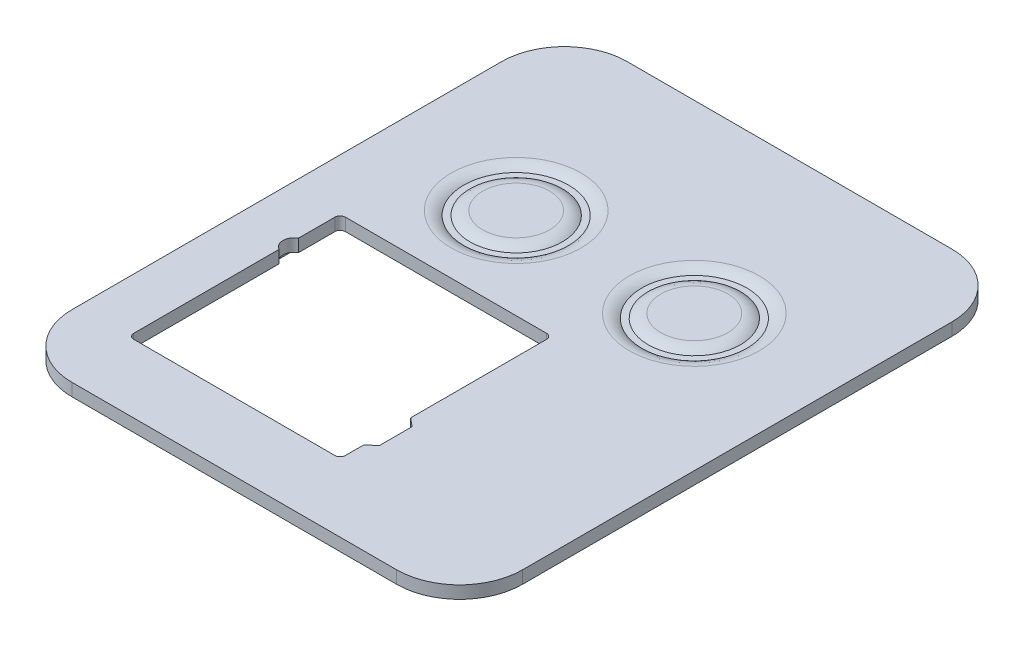
from build123d import *

# Parameters (mm, degrees)
BOSS_EXTRUDE1_DEPTH = 0.6
CUT_EXTRUDE1_DEPTH  = 2
SKETCH3_R           = 0.525
CUT_EXTRUDE2_DEPTH  = 10
BOSS_EXTRUDE2_DEPTH = 0.5
SKETCH5_R           = 2.5
BOSS_EXTRUDE3_DEPTH = 1.3
SKETCH6_R           = 2.5
SKETCH6_R_2         = 2.2
CUT_EXTRUDE3_DEPTH  = 0.2
FILLET1_R           = 1
CHAMFER1_SIZE       = 1


with BuildPart() as part:
    # Sketch1 → Boss-Extrude1 (new body)
    with BuildSketch(Plane(origin=(0, 0, 0), x_dir=(1, 0, 0), z_dir=(0, 1, 0))):
        with BuildLine():
            Line((-7.75, -13.25), (7.75, -13.25))
            ThreePointArc((7.75, -13.25), (9.871320344, -12.371320344), (10.75, -10.25))
            Line((10.75, -10.25), (10.75, 10.25))
            ThreePointArc((10.75, 10.25), (9.871320344, 12.371320344), (7.75, 13.25))
            Line((7.75, 13.25), (-7.75, 13.25))
            ThreePointArc((-7.75, 13.25), (-9.871320344, 12.371320344), (-10.75, 10.25))
            Line((-10.75, 10.25), (-10.75, -10.25))
            ThreePointArc((-10.75, -10.25), (-9.871320344, -12.371320344), (-7.75, -13.25))
        make_face()
    extrude(amount=BOSS_EXTRUDE1_DEPTH)

    # Sketch2 → Cut-Extrude1 (cut)
    with BuildSketch(Plane(origin=(0, 0.6, 0), x_dir=(1, 0, 0), z_dir=(0, 1, 0))):
        with BuildLine():
            Line((1.55, -10), (-8.05, -10))
            ThreePointArc((-8.05, -10), (-8.226776695, -9.926776695), (-8.3, -9.75))
            Line((-8.3, -9.75), (-8.3, -0.15))
            ThreePointArc((-8.3, -0.15), (-8.226776695, 0.026776695), (-8.05, 0.1))
            Line((-8.05, 0.1), (1.55, 0.1))
            ThreePointArc((1.55, 0.1), (1.726776695, 0.026776695), (1.8, -0.15))
            Line((1.8, -0.15), (1.8, -9.75))
            ThreePointArc((1.8, -9.75), (1.726776695, -9.926776695), (1.55, -10))
        make_face()
    extrude(amount=-CUT_EXTRUDE1_DEPTH, mode=Mode.SUBTRACT)

    # Sketch3 → Cut-Extrude2 (cut)
    with BuildSketch(Plane(origin=(0, 0.6, 0), x_dir=(1, 0, 0), z_dir=(0, 1, 0))):
        with Locations((-8.05, -2.35)):
            Circle(SKETCH3_R)
        Polygon((2.2, -6.969264593), (2.2, -8.531138717), (1.8, -8.867190969), (1.8, -6.633227233), align=None)
    extrude(amount=-CUT_EXTRUDE2_DEPTH, mode=Mode.SUBTRACT)

    # Sketch4 → Boss-Extrude2 (add)
    with BuildSketch(Plane(origin=(0, 0, 0), x_dir=(-1, 0, 0), z_dir=(0, -1, 0))):
        with BuildLine():
            Line((7.75, 12.25), (-7.75, 12.25))
            ThreePointArc((-7.75, 12.25), (-9.164213562, 11.664213562), (-9.75, 10.25))
            Line((-9.75, 10.25), (-9.75, -10.25))
            ThreePointArc((-9.75, -10.25), (-9.164213562, -11.664213562), (-7.75, -12.25))
            Line((-7.75, -12.25), (7.75, -12.25))
            ThreePointArc((7.75, -12.25), (9.164213562, -11.664213562), (9.75, -10.25))
            Line((9.75, -10.25), (9.75, 10.25))
            ThreePointArc((9.75, 10.25), (9.164213562, 11.664213562), (7.75, 12.25))
        make_face()
        with BuildLine():
            Line((7.75, 11.5), (-7.75, 11.5))
            ThreePointArc((-7.75, 11.5), (-8.633883476, 11.133883476), (-9, 10.25))
            Line((-9, 10.25), (-9, -10.25))
            ThreePointArc((-9, -10.25), (-8.633883476, -11.133883476), (-7.75, -11.5))
            Line((-7.75, -11.5), (7.75, -11.5))
            ThreePointArc((7.75, -11.5), (8.633883476, -11.133883476), (9, -10.25))
            Line((9, -10.25), (9, 10.25))
            ThreePointArc((9, 10.25), (8.633883476, 11.133883476), (7.75, 11.5))
        make_face(mode=Mode.SUBTRACT)
    extrude(amount=BOSS_EXTRUDE2_DEPTH)

    # Sketch5 → Boss-Extrude3 (add)
    with BuildSketch(Plane(origin=(0, 0, 0), x_dir=(-1, 0, 0), z_dir=(0, -1, 0))):
        with Locations(Location((-4.25, 4.45, 0), (0, 0, 90))):
            Circle(SKETCH5_R)
        with Locations(Location((4.25, 4.45, 0), (0, 0, 90))):
            Circle(SKETCH5_R)
    extrude(amount=BOSS_EXTRUDE3_DEPTH)

    # Sketch6 → Cut-Extrude3 (cut)
    # profile 1 of 2: a face of its own
    with BuildSketch(Plane(origin=(0, 0.6, 0), x_dir=(1, 0, 0), z_dir=(0, 1, 0))):
        with Locations(Location((4.25, 4.45, 0), (0, 0, 90))):
            Circle(SKETCH6_R)
        with Locations(Location((4.25, 4.45, 0), (0, 0, 270))):
            Circle(SKETCH6_R_2, mode=Mode.SUBTRACT)
    # profile 2 of 2: a face of its own
    with BuildSketch(Plane(origin=(0, 0.6, 0), x_dir=(1, 0, 0), z_dir=(0, 1, 0))):
        with Locations(Location((-4.25, 4.45, 0), (0, 0, 90))):
            Circle(SKETCH6_R)
        with Locations(Location((-4.25, 4.45, 0), (0, 0, 270))):
            Circle(SKETCH6_R_2, mode=Mode.SUBTRACT)
    extrude(amount=-CUT_EXTRUDE3_DEPTH, mode=Mode.SUBTRACT)

    # Fillet1
    # the kernel refuses this fillet: 1 mm, written as the material it takes off along each edge
    with BuildSketch(Plane(origin=(4.25, 0.6, -4.45), x_dir=(0, 0, -1), z_dir=(1, 0, 0))) as fillet1_piece_1:
        with BuildLine():
            CenterArc((3.1, -1), FILLET1_R, 90, 36.869897646)
            Line((2.5, -0.2), (2.488, -0.184))
            ThreePointArc((2.488, -0.184), (2.48, -0.1), (2.48, 0))
            Line((2.48, 0), (2.5, 0.02))
            Line((2.5, 0.02), (3.1, 0.02))
            Line((3.1, 0.02), (3.1, 0))
        make_face()
    revolve(axis=Axis((4.25, 0.6, -4.45), (0, 1, 0)), mode=Mode.SUBTRACT)
    with BuildSketch(Plane(origin=(4.25, 0.6, -4.45), x_dir=(0, 0, 1), z_dir=(-1, 0, 0))) as fillet1_piece_2:
        with BuildLine():
            CenterArc((1.6, -1), FILLET1_R, 53.130102354, 36.869897646)
            Line((1.6, 0), (1.6, 0.02))
            Line((1.6, 0.02), (2.2, 0.02))
            Line((2.2, 0.02), (2.22, 0))
            ThreePointArc((2.22, 0), (2.22, -0.1), (2.212, -0.184))
            Line((2.212, -0.184), (2.2, -0.2))
        make_face()
    revolve(axis=Axis((4.25, 0.6, -4.45), (0, 1, 0)), mode=Mode.SUBTRACT)
    with BuildSketch(Plane(origin=(-4.25, 0.6, -4.45), x_dir=(0, 0, -1), z_dir=(1, 0, 0))) as fillet1_piece_3:
        with BuildLine():
            CenterArc((3.1, -1), FILLET1_R, 90, 36.869897646)
            Line((2.5, -0.2), (2.488, -0.184))
            ThreePointArc((2.488, -0.184), (2.48, -0.1), (2.48, 0))
            Line((2.48, 0), (2.5, 0.02))
            Line((2.5, 0.02), (3.1, 0.02))
            Line((3.1, 0.02), (3.1, 0))
        make_face()
    revolve(axis=Axis((-4.25, 0.6, -4.45), (0, 1, 0)), mode=Mode.SUBTRACT)
    with BuildSketch(Plane(origin=(-4.25, 0.6, -4.45), x_dir=(0, 0, 1), z_dir=(-1, 0, 0))) as fillet1_piece_4:
        with BuildLine():
            CenterArc((1.6, -1), FILLET1_R, 53.130102354, 36.869897646)
            Line((1.6, 0), (1.6, 0.02))
            Line((1.6, 0.02), (2.2, 0.02))
            Line((2.2, 0.02), (2.22, 0))
            ThreePointArc((2.22, 0), (2.22, -0.1), (2.212, -0.184))
            Line((2.212, -0.184), (2.2, -0.2))
        make_face()
    revolve(axis=Axis((-4.25, 0.6, -4.45), (0, 1, 0)), mode=Mode.SUBTRACT)

    # Chamfer1
    chamfer1_edges = [part.edges().sort_by_distance(p)[0] for p in [
        (4.25, -1.3, -1.95),
        (-4.25, -1.3, -1.95),
    ]]
    chamfer(chamfer1_edges, length=CHAMFER1_SIZE)


solid = part.part
